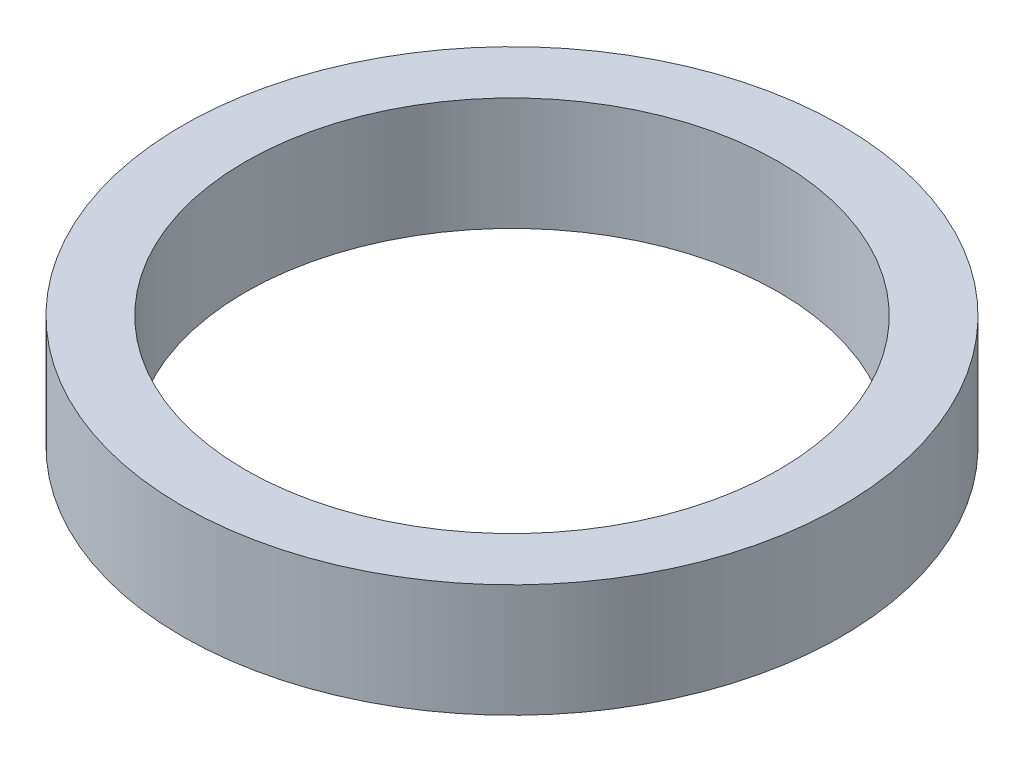
from build123d import *

# Parameters (mm, degrees)
SKETCH1_R           = 52.5
BOSS_EXTRUDE1_DEPTH = 18
SKETCH2_R           = 42.5
CUT_EXTRUDE1_DEPTH  = 77.396989469


with BuildPart() as part:
    # Sketch1 → Boss-Extrude1 (new body)
    with BuildSketch(Plane(origin=(0, 0, 0), x_dir=(1, 0, 0), z_dir=(0, 1, 0))):
        Circle(SKETCH1_R)
    extrude(amount=BOSS_EXTRUDE1_DEPTH)

    # Sketch2 → Cut-Extrude1 (cut, through all)
    with BuildSketch(Plane(origin=(0, 0, 0), x_dir=(1, 0, 0), z_dir=(0, 1, 0))):
        Circle(SKETCH2_R)
    extrude(amount=CUT_EXTRUDE1_DEPTH, mode=Mode.SUBTRACT)


solid = part.part
